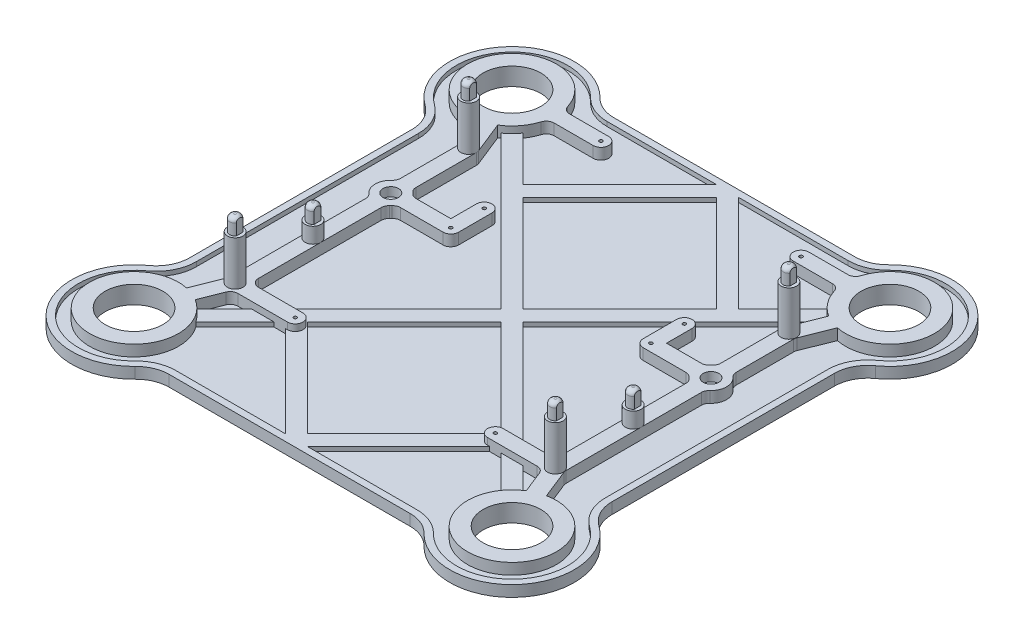
from build123d import *
from build123d.topology import SkipClean

# Parameters (mm, degrees)
SKETCH1_R                = 13
BASE_DEPTH               = 3
THIN_RIM_DEPTH           = 2
SKETCH4_R                = 20
SKETCH4_R_2              = 13
WHEEL_MOUNT_DEPTH        = 8
SKETCH5_R                = 3.5
UPPER_BASE_MOUNT_DEPTH   = 25
UPPER_BASE_MOUNT_2_DEPTH = 25
GEAR_RIM_DEPTH           = 5
SKETCH5_3_R              = 3.5
GEAR_MOUNT_DEPTH         = 12
SKETCH12_R               = 3.5
SERVO_GEAR_MOUNT_DEPTH   = 4
GEAR_RIM_FILLET_R        = 3.5
UPPER_BASE_FIXERS_DEPTH  = 7
GEAR_FIXER_DEPTH         = 7
FIXER_FILLET_R           = 2
BOSS_EXTRUDE1_DEPTH      = 2
SKETCH23_R               = 0.75
CUT_EXTRUDE1_DEPTH       = 163.070972125


# Read off the part's stored shape, not the designer's step: Mirror1
# Some blends are built 0.0001 mm under size
with BuildPart() as part:
    # Sketch1 → Base (new body)
    with BuildSketch(Plane(origin=(0, 0, 0), x_dir=(1, 0, 0), z_dir=(0, 1, 0))):
        with BuildLine():
            Line((0, 100), (54.194156399, 100))
            ThreePointArc((54.194156399, 100), (60.026105293, 101.180145728), (64.940380911, 104.534883721))
            ThreePointArc((64.940380911, 104.534883721), (106.242409625, 103.241711359), (101.279069767, 62.21860655))
            ThreePointArc((101.279069767, 62.21860655), (96.661822585, 56.876724296), (95, 50.014288631))
            Line((95, 50.014288631), (95, -50.014288631))
            ThreePointArc((95, -50.014288631), (96.661822585, -56.876724296), (101.279069767, -62.21860655))
            ThreePointArc((101.279069767, -62.21860655), (106.242409625, -103.241711359), (64.940380911, -104.534883721))
            ThreePointArc((64.940380911, -104.534883721), (60.026105293, -101.180145728), (54.194156399, -100))
            Line((54.194156399, -100), (0, -100))
            Line((0, -100), (0, 100))
        make_face()
        with Locations(Location((85, 85, 0), (0, 0, 270))):
            Circle(SKETCH1_R, mode=Mode.SUBTRACT)
        with Locations(Location((85, -85, 0), (0, 0, 90))):
            Circle(SKETCH1_R, mode=Mode.SUBTRACT)
    extrude(amount=BASE_DEPTH)

    # Sketch2 → thin rim (add)
    with SkipClean():  # the faces are left unmerged after this step: merging them gives an invalid solid
        with BuildSketch(Plane(origin=(0, 3, 0), x_dir=(1, 0, 0), z_dir=(0, 1, 0))):
            with BuildLine():
                Line((0, -100), (54.194156399, -100))
                ThreePointArc((54.194156399, -100), (60.026105293, -101.180145728), (64.940380911, -104.534883721))
                ThreePointArc((64.940380911, -104.534883721), (106.242409625, -103.241711359), (101.279069767, -62.21860655))
                ThreePointArc((101.279069767, -62.21860655), (96.661822585, -56.876724296), (95, -50.014288631))
                Line((95, -50.014288631), (95, 50.014288631))
                ThreePointArc((95, 50.014288631), (96.661822585, 56.876724296), (101.279069767, 62.21860655))
                ThreePointArc((101.279069767, 62.21860655), (106.242409625, 103.241711359), (64.940380911, 104.534883721))
                ThreePointArc((64.940380911, 104.534883721), (60.026105293, 101.180145728), (54.194156399, 100))
                Line((54.194156399, 100), (0, 100))
                Line((0, 100), (0, 97))
                Line((0, 97), (54.194156399, 97))
                ThreePointArc((54.194156399, 97), (61.192495072, 98.416174874), (67.089625813, 102.441860465))
                ThreePointArc((67.089625813, 102.441860465), (103.966437165, 101.287242285), (99.534883721, 64.659470134))
                ThreePointArc((99.534883721, 64.659470134), (93.994187102, 58.249211429), (92, 50.014288631))
                Line((92, 50.014288631), (92, -50.014288631))
                ThreePointArc((92, -50.014288631), (93.994187102, -58.249211429), (99.534883721, -64.659470134))
                ThreePointArc((99.534883721, -64.659470134), (103.966437165, -101.287242285), (67.089625813, -102.441860465))
                ThreePointArc((67.089625813, -102.441860465), (61.192495072, -98.416174874), (54.194156399, -97))
                Line((54.194156399, -97), (0, -97))
                Line((0, -97), (0, -100))
            make_face()
        extrude(amount=THIN_RIM_DEPTH)

    # Sketch4 → wheel mount (add)
    # profile 1 of 2: a face of its own
    with SkipClean():  # the faces are left unmerged after this step: merging them gives an invalid solid
        with BuildSketch(Plane.XZ):
            with Locations((85, 85)):
                Circle(SKETCH4_R)
            with Locations((85, 85)):
                Circle(SKETCH4_R_2, mode=Mode.SUBTRACT)
        # profile 2 of 2: a face of its own
        with BuildSketch(Plane.XZ):
            with Locations((85, -85)):
                Circle(SKETCH4_R)
            with Locations((85, -85)):
                Circle(SKETCH4_R_2, mode=Mode.SUBTRACT)
        extrude(amount=-WHEEL_MOUNT_DEPTH)



with BuildPart() as body_2:
    # Sketch5 → upper base mount (new body)
    with BuildSketch(Plane(origin=(0, 3, 0), x_dir=(1, 0, 0), z_dir=(0, 1, 0))):
        with Locations(Location((72.009618943, -52.5, 0), (0, 0, 270))):
            Circle(SKETCH5_R)
    extrude(amount=UPPER_BASE_MOUNT_DEPTH)


with BuildPart() as body_3:
    # Sketch5 → upper base mount 2 (new body)
    with BuildSketch(Plane(origin=(0, 3, 0), x_dir=(1, 0, 0), z_dir=(0, 1, 0))):
        with Locations(Location((72.009618943, 52.5, 0), (0, 0, 270))):
            Circle(SKETCH5_R)
    extrude(amount=UPPER_BASE_MOUNT_2_DEPTH)


with BuildPart() as part_1:
    with SkipClean():  # the faces are left unmerged after this step: merging them gives an invalid solid
        add(part.part)

        add(body_2.part)  # gear rim merges body 2

        add(body_3.part)  # gear rim merges body 3
        # Sketch11 → gear rim (add)
        with BuildSketch(Plane(origin=(0, 3, 0), x_dir=(1, 0, 0), z_dir=(0, 1, 0))):
            with BuildLine():
                Line((74.441474785, 68.014195772), (68.509618943, 53.173575314))
                Line((68.509618943, 53.173575314), (68.509618943, 23.562177826))
                ThreePointArc((68.509618943, 23.562177826), (67.059871475, 22.449747468), (65.947441117, 21))
                Line((65.947441117, 21), (48.5, 21))
                Line((48.5, 21), (48.5, 32.5))
                ThreePointArc((48.5, 32.5), (45, 36), (41.5, 32.5))
                Line((41.5, 32.5), (41.5, 17.5))
                ThreePointArc((41.5, 17.5), (42.525126266, 15.025126266), (45, 14))
                Line((45, 14), (65.947441117, 14))
                ThreePointArc((65.947441117, 14), (67.059871475, 12.550252532), (68.509618943, 11.437822174))
                Line((68.509618943, 11.437822174), (68.509618943, -49))
                Line((68.509618943, -49), (45, -49))
                ThreePointArc((45, -49), (41.5, -52.5), (45, -56))
                Line((45, -56), (69.639352288, -56))
                Line((69.639352288, -56), (74.441474785, -68.014195772))
                ThreePointArc((74.441474785, -68.014195772), (77.57692511, -66.428571429), (80.941474785, -65.41611956))
                Line((80.941474785, -65.41611956), (75.509618943, -51.826424686))
                Line((75.509618943, -51.826424686), (75.509618943, 11.437822174))
                ThreePointArc((75.509618943, 11.437822174), (79.009618943, 17.5), (75.509618943, 23.562177826))
                Line((75.509618943, 23.562177826), (75.509618943, 51.826424686))
                Line((75.509618943, 51.826424686), (80.941474785, 65.41611956))
                ThreePointArc((80.941474785, 65.41611956), (77.57692511, 66.428571429), (74.441474785, 68.014195772))
            make_face()
            with BuildLine():
                Line((65.308631332, 88.5), (45, 88.5))
                ThreePointArc((45, 88.5), (41.5, 85), (45, 81.5))
                Line((45, 81.5), (65.308631332, 81.5))
                Line((65.308631332, 81.5), (65.308631332, 88.5))
            make_face()
        extrude(amount=GEAR_RIM_DEPTH)

    # Sketch5<3> → gear mount (add)
    with SkipClean():  # the faces are left unmerged after this step: merging them gives an invalid solid
        with BuildSketch(Plane(origin=(0, 3, 0), x_dir=(1, 0, 0), z_dir=(0, 1, 0))):
            with Locations(Location((72.009618943, -17.5, 0), (0, 0, 180))):
                Circle(SKETCH5_3_R)
        extrude(amount=GEAR_MOUNT_DEPTH)

    # Sketch12 → servo gear mount (cut)
    with SkipClean():  # the faces are left unmerged after this step: merging them gives an invalid solid
        with BuildSketch(Plane(origin=(0, 8, 0), x_dir=(1, 0, 0), z_dir=(0, 1, 0))):
            with Locations(Location((72.009618943, 17.5, 0), (0, 0, 270))):
                Circle(SKETCH12_R)
        extrude(amount=-SERVO_GEAR_MOUNT_DEPTH, mode=Mode.SUBTRACT)

    # gear rim fillet
    gear_rim_fillet_edges = [part_1.edges().sort_by_distance(p)[0] for p in [
        (75.509618943, 5.5, -51.826424686),
        (75.509618943, 5.5, -23.562177826),
        (75.509618943, 5.5, -11.437822174),
        (75.509618943, 5.5, 51.826424686),
        (68.509618943, 5.5, -23.562177826),
        (69.639352288, 5.5, 56),
        (68.509618943, 5.5, 49),
        (68.509618943, 5.5, -11.437822174),
        (65.947441117, 5.5, -14),
        (65.947441117, 5.5, -21),
        (65.308631332, 5.5, -88.5),
        (65.308631332, 5.5, -81.5),
    ]]
    fillet(gear_rim_fillet_edges, radius=GEAR_RIM_FILLET_R)
    gear_rim_fillet_2_edges = [part_1.edges().sort_by_distance(p)[0] for p in [
        (68.509618943, 5.5, -53.173575314),
    ]]
    fillet(gear_rim_fillet_2_edges, radius=GEAR_RIM_FILLET_R - 0.0004)  # a hair under: the kernel refuses the full size

    # Sketch13 → upper base fixers (add)
    with BuildSketch(Plane(origin=(0, 28, 0), x_dir=(1, 0, 0), z_dir=(0, 1, 0))):
        with BuildLine():
            Line((74.009618943, 54), (74.009618943, 51))
            ThreePointArc((74.009618943, 51), (72.009618943, 50), (70.009618943, 51))
            Line((70.009618943, 51), (70.009618943, 54))
            ThreePointArc((70.009618943, 54), (72.009618943, 55), (74.009618943, 54))
        make_face()
        with BuildLine():
            Line((74.009618943, -51), (74.009618943, -54))
            ThreePointArc((74.009618943, -54), (72.009618943, -55), (70.009618943, -54))
            Line((70.009618943, -54), (70.009618943, -51))
            ThreePointArc((70.009618943, -51), (72.009618943, -50), (74.009618943, -51))
        make_face()
    extrude(amount=UPPER_BASE_FIXERS_DEPTH)

    # Sketch14 → gear fixer (add)
    with BuildSketch(Plane(origin=(0, 15, 0), x_dir=(1, 0, 0), z_dir=(0, 1, 0))):
        with BuildLine():
            Line((74.009618943, -19), (74.009618943, -16))
            ThreePointArc((74.009618943, -16), (72.009618943, -15), (70.009618943, -16))
            Line((70.009618943, -16), (70.009618943, -19))
            ThreePointArc((70.009618943, -19), (72.009618943, -20), (74.009618943, -19))
        make_face()
    extrude(amount=GEAR_FIXER_DEPTH)

    # fixer fillet
    # the kernel refuses this fillet: 2 mm, written as the material it takes off along each edge
    with BuildSketch(Plane(origin=(72.009618943, 35, -52.5), x_dir=(-0.21156640445091165, 0, 0.977363625529267), z_dir=(0.977363625529267, 0, 0.21156640445091165))) as fixer_fillet_piece_1:
        with BuildLine():
            CenterArc((2.5 - FIXER_FILLET_R, FIXER_FILLET_R), FIXER_FILLET_R, 270, 90)
            Line((2.5 - FIXER_FILLET_R, 0), (2.5, 0))
            Line((2.5, 0), (2.5, FIXER_FILLET_R))
        make_face()
    revolve(axis=Axis((72.009618943, 35, -52.5), (0, -1, 0)), revolution_arc=335.57167329, mode=Mode.SUBTRACT)
    with BuildSketch(Plane(origin=(72.009618943, 35, -52.5), x_dir=(0.2115664044509068, 0, -0.977363625529268), z_dir=(-0.977363625529268, 0, -0.2115664044509068))) as fixer_fillet_piece_2:
        with BuildLine():
            CenterArc((2.5 - FIXER_FILLET_R, FIXER_FILLET_R), FIXER_FILLET_R, 270, 90)
            Line((2.5 - FIXER_FILLET_R, 0), (2.5, 0))
            Line((2.5, 0), (2.5, FIXER_FILLET_R))
        make_face()
    revolve(axis=Axis((72.009618943, 35, -52.5), (0, -1, 0)), revolution_arc=335.57167329, mode=Mode.SUBTRACT)
    with BuildSketch(Plane(origin=(72.009618943, 35, 52.5), x_dir=(-0.21156640445090139, 0, 0.9773636255292693), z_dir=(0.9773636255292693, 0, 0.21156640445090139))) as fixer_fillet_piece_3:
        with BuildLine():
            CenterArc((2.5 - FIXER_FILLET_R, FIXER_FILLET_R), FIXER_FILLET_R, 270, 90)
            Line((2.5 - FIXER_FILLET_R, 0), (2.5, 0))
            Line((2.5, 0), (2.5, FIXER_FILLET_R))
        make_face()
    revolve(axis=Axis((72.009618943, 35, 52.5), (0, -1, 0)), revolution_arc=335.57167329, mode=Mode.SUBTRACT)
    with BuildSketch(Plane(origin=(72.009618943, 35, 52.5), x_dir=(0.21156640445086883, 0, -0.9773636255292764), z_dir=(-0.9773636255292764, 0, -0.21156640445086883))) as fixer_fillet_piece_4:
        with BuildLine():
            CenterArc((2.5 - FIXER_FILLET_R, FIXER_FILLET_R), FIXER_FILLET_R, 270, 90)
            Line((2.5 - FIXER_FILLET_R, 0), (2.5, 0))
            Line((2.5, 0), (2.5, FIXER_FILLET_R))
        make_face()
    revolve(axis=Axis((72.009618943, 35, 52.5), (0, -1, 0)), revolution_arc=335.57167329, mode=Mode.SUBTRACT)
    with BuildSketch(Plane(origin=(72.009618943, 22, 17.5), x_dir=(-0.21156640445088568, 0, -0.9773636255292726), z_dir=(0.9773636255292726, 0, -0.21156640445088568))) as fixer_fillet_piece_5:
        with BuildLine():
            CenterArc((2.5 - FIXER_FILLET_R, -FIXER_FILLET_R), FIXER_FILLET_R, 0, 90)
            Line((2.5 - FIXER_FILLET_R, 0), (2.5, 0))
            Line((2.5, 0), (2.5, -FIXER_FILLET_R))
        make_face()
    revolve(axis=Axis((72.009618943, 22, 17.5), (0, 1, 0)), revolution_arc=335.57167329, mode=Mode.SUBTRACT)
    with BuildSketch(Plane(origin=(72.009618943, 22, 17.5), x_dir=(0.21156640445085734, 0, 0.9773636255292787), z_dir=(-0.9773636255292787, 0, 0.21156640445085734))) as fixer_fillet_piece_6:
        with BuildLine():
            CenterArc((2.5 - FIXER_FILLET_R, -FIXER_FILLET_R), FIXER_FILLET_R, 0, 90)
            Line((2.5 - FIXER_FILLET_R, 0), (2.5, 0))
            Line((2.5, 0), (2.5, -FIXER_FILLET_R))
        make_face()
    revolve(axis=Axis((72.009618943, 22, 17.5), (0, 1, 0)), revolution_arc=335.57167329, mode=Mode.SUBTRACT)

    # Sketch22 → Boss-Extrude1 (add)
    with BuildSketch(Plane(origin=(0, 3, 0), x_dir=(1, 0, 0), z_dir=(0, 1, 0))):
        Polygon((68.60122595, -73.550973419), (48.5, -53.449747468), (4.949747468, -97), (0, -97), (0, -92.050252532), (43.550252532, -48.5), (0, -4.949747468), (0, 4.949747468), (43.550252532, 48.5), (0, 92.050252532), (0, 97), (4.949747468, 97), (48.5, 53.449747468), (68.60122595, 73.550973419), (73.550973419, 68.60122595), (4.949747468, 0), (73.550973419, -68.60122595), align=None)
    extrude(amount=BOSS_EXTRUDE1_DEPTH)

    # Sketch23 → Cut-Extrude1 (cut, through all)
    with BuildSketch(Plane(origin=(0, 8, 0), x_dir=(1, 0, 0), z_dir=(0, 1, 0))):
        with Locations(Location((45, -52.5, 0), (0, 0, 270))):
            Circle(SKETCH23_R)
        with Locations(Location((45, 17.5, 0), (0, 0, 270))):
            Circle(SKETCH23_R)
        with Locations(Location((45, 32.5, 0), (0, 0, 270))):
            Circle(SKETCH23_R)
        with Locations(Location((45, 85, 0), (0, 0, 270))):
            Circle(SKETCH23_R)
    extrude(amount=-CUT_EXTRUDE1_DEPTH, mode=Mode.SUBTRACT)

    # Mirror1: part across plane


with BuildPart() as part_2:
    add(part_1.part)
    add(part_1.part.mirror(Plane(origin=(0, 0, 0), x_dir=(0, 0, 1), z_dir=(1, 0, 0))))


solid = part_2.part
